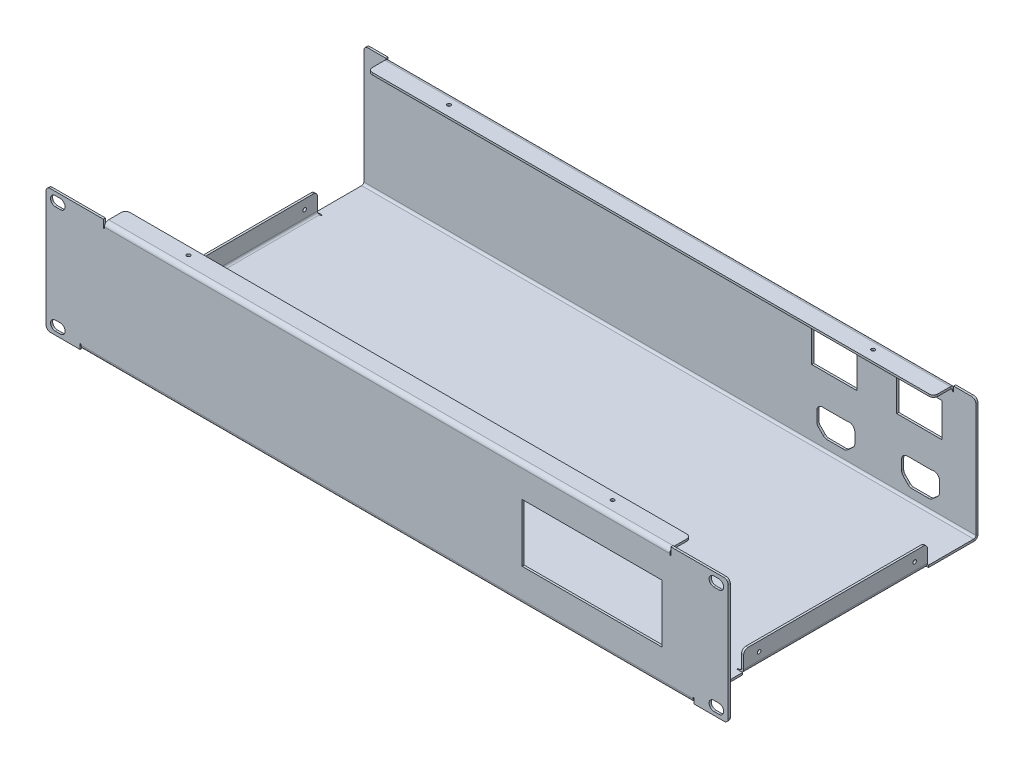
from build123d import *

# Parameters (mm, degrees)
SKETCH_1_W                        = 482.6
SKETCH_1_H                        = 88.1
SM_BASE_FLANGE_1_DEPTH            = 1.5
FILLET_1_R                        = 3
CUT_EXTRUDE_1_DEPTH               = 246.292361275
PATTERN_LINEAR_1_COUNT            = 2
PATTERN_LINEAR_1_PITCH            = 76.2
MIRROR_1_COPY_1_DEPTH             = 246.292361275
SM_START                          = -3
SM_EDGE_FLANGE_1_DEPTH            = 4
SM_START_2                        = -15
SM_EDGE_FLANGE_1_2_OUTLINE_W      = 400
SM_EDGE_FLANGE_1_2_OUTLINE_H      = 1.5
SM_EDGE_FLANGE_1_2_DEPTH          = 12
SM_START_3                        = -200
SM_EDGE_FLANGE_1_3_DEPTH          = 400
SM_EDGE_FLANGE_1_4_DEPTH          = 400
SM_EDGE_FLANGE_2_STRIP_W          = 9
SM_EDGE_FLANGE_2_STRIP_H          = 1.5
SM_EDGE_FLANGE_2_STRIP_CUT_DEPTH  = 433
SM_EDGE_FLANGE_2_RELIEF_W         = 9.75
SM_EDGE_FLANGE_2_RELIEF_H         = 0.75
SM_EDGE_FLANGE_2_RELIEF_CUT_DEPTH = 1.5
SM_EDGE_FLANGE_2_DEPTH            = 433
SM_EDGE_FLANGE_3_STRIP_W          = 10.5
SM_EDGE_FLANGE_3_STRIP_H          = 1.5
SM_EDGE_FLANGE_3_STRIP_CUT_DEPTH  = 433
SM_EDGE_FLANGE_3_DEPTH            = 433
SM_EDGE_FLANGE_4_STRIP_W          = 9
SM_EDGE_FLANGE_4_STRIP_H          = 1.5
SM_EDGE_FLANGE_4_STRIP_CUT_DEPTH  = 400
SM_EDGE_FLANGE_4_RELIEF_W         = 9.75
SM_EDGE_FLANGE_4_RELIEF_H         = 0.75
SM_EDGE_FLANGE_4_RELIEF_CUT_DEPTH = 1.5
SM_EDGE_FLANGE_4_DEPTH            = 400
SM_START_4                        = -45
SM_EDGE_FLANGE_5_DEPTH            = 1.09589
SM_START_5                        = -43.90843
SM_EDGE_FLANGE_5_2_DEPTH          = 2.85843
SM_START_6                        = -41.05
SM_EDGE_FLANGE_5_3_OUTLINE_W      = 1.5
SM_EDGE_FLANGE_5_3_OUTLINE_H      = 130
SM_EDGE_FLANGE_5_3_DEPTH          = 12
SM_START_7                        = -165.75
SM_EDGE_FLANGE_5_4_DEPTH          = 130
SM_EDGE_FLANGE_5_5_DEPTH          = 130
FILLET_2_R                        = 3
SKETCH_24_R                       = 1.25
CUT_EXTRUDE_2_DEPTH               = 503.119002329
CUT_EXTRUDE_START                 = -1.5
SKETCH_25_R                       = 1.25
CUT_EXTRUDE_3_DEPTH               = 1.5
SKETCH1_W                         = 32
SKETCH1_H                         = 24
CUT_EXTRUDE1_DEPTH                = 10
SKETCH2_W                         = 99
SKETCH2_H                         = 41
CUT_EXTRUDE2_DEPTH                = 11


with BuildPart() as part:
    # Базовая кромка1: sheet metal written as solids
    # Sketch 1 → Базовая кромка1 (new body)
    with BuildSketch(Plane.XY):
        Rectangle(SKETCH_1_W, SKETCH_1_H)
    extrude(amount=-SM_BASE_FLANGE_1_DEPTH)

    # Скругление1
    fillet_1_edges = [part.edges().sort_by_distance(p)[0] for p in [
        (-241.3, 44.05, -0.75),
        (241.3, 44.05, -0.75),
        (241.3, -44.05, -0.75),
        (-241.3, -44.05, -0.75),
    ]]
    fillet(fillet_1_edges, radius=FILLET_1_R)

    # Эскиз6 → Вырез-Вытянуть1 (cut, through all)
    with BuildSketch(Plane.XY):
        with BuildLine():
            Line((-234.7, -34.75), (-231.2, -34.75))
            ThreePointArc((-231.2, -34.75), (-227.8, -38.15), (-231.2, -41.55))
            Line((-231.2, -41.55), (-234.7, -41.55))
            ThreePointArc((-234.7, -41.55), (-238.1, -38.15), (-234.7, -34.75))
        make_face()
    cut_extrude_1 = extrude(amount=-CUT_EXTRUDE_1_DEPTH, mode=Mode.SUBTRACT)

    # Линейный массив1: Вырез-Вытянуть1 ×2
    with Locations(*[(0, i * PATTERN_LINEAR_1_PITCH, 0) for i in range(1, PATTERN_LINEAR_1_COUNT)]):
        add(cut_extrude_1, mode=Mode.SUBTRACT)

    # Зеркальное отражение1: Вырез-Вытянуть1 across plane
    add(cut_extrude_1.mirror(Plane(origin=(0, 0, 0), x_dir=(0, 0, 1), z_dir=(1, 0, 0))), mode=Mode.SUBTRACT)

    # Зеркальное отражение1 copy 1 sketch → Зеркальное отражение1 copy 1 (cut, through all)
    with BuildSketch(Plane(origin=(0, 76.2, 0), x_dir=(-1, 0, 0), z_dir=(0, 0, 1))):
        with BuildLine():
            Line((-234.7, 34.75), (-231.2, 34.75))
            ThreePointArc((-231.2, 34.75), (-227.8, 38.15), (-231.2, 41.55))
            Line((-231.2, 41.55), (-234.7, 41.55))
            ThreePointArc((-234.7, 41.55), (-238.1, 38.15), (-234.7, 34.75))
        make_face()
    extrude(amount=-MIRROR_1_COPY_1_DEPTH, mode=Mode.SUBTRACT)

    # Ребро-кромка1: read off the stored shape, not the designer's step
    # Ребро-кромка1 outline → Ребро-кромка1 (cut)
    with BuildSketch(Plane.XY.offset(SM_START)):
        with BuildLine():
            Line((200.75, 38.8), (200.75, 44.05))
            Line((200.75, 44.05), (-200.75, 44.05))
            Line((-200.75, 44.05), (-200.75, 38.8))
            ThreePointArc((-200.75, 38.8), (-200.375, 38.425), (-200, 38.8))
            Line((-200, 38.8), (-200, 42.55))
            Line((-200, 42.55), (200, 42.55))
            Line((200, 42.55), (200, 38.8))
            ThreePointArc((200, 38.8), (200.375, 38.425), (200.75, 38.8))
        make_face()
    extrude(amount=SM_EDGE_FLANGE_1_DEPTH, mode=Mode.SUBTRACT)

    # Sm Edge Flange 1 3 outline → Sm Edge Flange 1 3 (cut)
    with BuildSketch(Plane.YZ.offset(SM_START_3)):
        with BuildLine():
            ThreePointArc((39.55, 0), (41.05, -0.401923788), (42.148076212, -1.5))
            Line((42.148076212, -1.5), (42.55, -1.5))
            Line((42.55, -1.5), (42.55, 0))
            Line((42.55, 0), (39.55, 0))
        make_face()
    extrude(amount=SM_EDGE_FLANGE_1_3_DEPTH, mode=Mode.SUBTRACT)



with BuildPart() as body_2:
    # Sm Edge Flange 1 2 outline → Sm Edge Flange 1 2 (new body)
    with BuildSketch(Plane.XY.offset(SM_START_2)):
        with Locations((0, 41.8)):
            Rectangle(SM_EDGE_FLANGE_1_2_OUTLINE_W, SM_EDGE_FLANGE_1_2_OUTLINE_H)
    extrude(amount=SM_EDGE_FLANGE_1_2_DEPTH)


with BuildPart() as part_1:
    add(part.part)

    add(body_2.part)  # Sm Edge Flange 1 4 merges body 2
    # Sm Edge Flange 1 4 outline → Sm Edge Flange 1 4 (add)
    with BuildSketch(Plane.YZ.offset(SM_START_3)):
        with BuildLine():
            Line((41.05, -3), (42.55, -3))
            ThreePointArc((42.55, -3), (42.447777479, -2.223542865), (42.148076212, -1.5))
            Line((42.148076212, -1.5), (39.55, -1.5))
            ThreePointArc((39.55, -1.5), (40.610660172, -1.939339828), (41.05, -3))
        make_face()
    extrude(amount=SM_EDGE_FLANGE_1_4_DEPTH)

    # Ребро-кромка2: sheet metal written as solids
    # Ребро-кромка2 strip (on a plane across the edge) → Ребро-кромка2 strip cut (cut)
    with BuildSketch(Plane(origin=(216.5, -44.05, -1.5), x_dir=(0, 1, 0), z_dir=(-1, 0, 0))):
        with Locations((-1.5, -0.75)):
            Rectangle(SM_EDGE_FLANGE_2_STRIP_W, SM_EDGE_FLANGE_2_STRIP_H)
    extrude(amount=SM_EDGE_FLANGE_2_STRIP_CUT_DEPTH, mode=Mode.SUBTRACT)

    # Ребро-кромка2 relief (on the sheet) → Ребро-кромка2 relief cut (cut)
    with BuildSketch(Plane(origin=(216.5, -41.05, -1.5), x_dir=(0, 1, 0), z_dir=(0, 0, -1))):
        with Locations((-4.125, 0.375)):
            Rectangle(SM_EDGE_FLANGE_2_RELIEF_W, SM_EDGE_FLANGE_2_RELIEF_H)
        with Locations((-4.125, -433.375)):
            Rectangle(SM_EDGE_FLANGE_2_RELIEF_W, SM_EDGE_FLANGE_2_RELIEF_H)
    extrude(amount=-SM_EDGE_FLANGE_2_RELIEF_CUT_DEPTH, mode=Mode.SUBTRACT)

    # Ребро-кромка2 section (on a plane across the edge) → Ребро-кромка2 (add)
    with BuildSketch(Plane(origin=(216.5, -44.05, -1.5), x_dir=(0, 1, 0), z_dir=(-1, 0, 0))):
        with BuildLine():
            Line((0, 1.5), (0, 198.5))
            Line((0, 198.5), (1.5, 198.5))
            Line((1.5, 198.5), (1.5, 1.5))
            ThreePointArc((1.5, 1.5), (1.939339828, 0.439339828), (3, 0))
            Line((3, 0), (3, -1.5))
            ThreePointArc((3, -1.5), (0.878679656, -0.621320344), (0, 1.5))
        make_face()
    extrude(amount=SM_EDGE_FLANGE_2_DEPTH)

    # Ребро-кромка3: sheet metal written as solids
    # Ребро-кромка3 strip (on a plane across the edge) → Ребро-кромка3 strip cut (cut)
    with BuildSketch(Plane(origin=(216.5, -42.55, -201.5), x_dir=(0, 0, 1), z_dir=(-1, 0, 0))):
        with Locations((-2.25, -0.75)):
            Rectangle(SM_EDGE_FLANGE_3_STRIP_W, SM_EDGE_FLANGE_3_STRIP_H)
    extrude(amount=SM_EDGE_FLANGE_3_STRIP_CUT_DEPTH, mode=Mode.SUBTRACT)

    # Ребро-кромка3 section (on a plane across the edge) → Ребро-кромка3 (add)
    with BuildSketch(Plane(origin=(216.5, -42.55, -201.5), x_dir=(0, 0, 1), z_dir=(-1, 0, 0))):
        with BuildLine():
            Line((0, 1.5), (0, 85.1))
            Line((0, 85.1), (1.5, 85.1))
            Line((1.5, 85.1), (1.5, 1.5))
            ThreePointArc((1.5, 1.5), (1.939339828, 0.439339828), (3, 0))
            Line((3, 0), (3, -1.5))
            ThreePointArc((3, -1.5), (0.878679656, -0.621320344), (0, 1.5))
        make_face()
    extrude(amount=SM_EDGE_FLANGE_3_DEPTH)

    # Ребро-кромка4: sheet metal written as solids
    # Ребро-кромка4 strip (on a plane across the edge) → Ребро-кромка4 strip cut (cut)
    with BuildSketch(Plane(origin=(200, 42.55, -200), x_dir=(0, -1, 0), z_dir=(-1, 0, 0))):
        with Locations((-1.5, -0.75)):
            Rectangle(SM_EDGE_FLANGE_4_STRIP_W, SM_EDGE_FLANGE_4_STRIP_H)
    extrude(amount=SM_EDGE_FLANGE_4_STRIP_CUT_DEPTH, mode=Mode.SUBTRACT)

    # Ребро-кромка4 relief (on the sheet) → Ребро-кромка4 relief cut (cut)
    with BuildSketch(Plane(origin=(200, 39.55, -200), x_dir=(0, -1, 0), z_dir=(0, 0, 1))):
        with Locations((-4.125, 0.375)):
            Rectangle(SM_EDGE_FLANGE_4_RELIEF_W, SM_EDGE_FLANGE_4_RELIEF_H)
        with Locations((-4.125, -400.375)):
            Rectangle(SM_EDGE_FLANGE_4_RELIEF_W, SM_EDGE_FLANGE_4_RELIEF_H)
    extrude(amount=-SM_EDGE_FLANGE_4_RELIEF_CUT_DEPTH, mode=Mode.SUBTRACT)

    # Ребро-кромка4 section (on a plane across the edge) → Ребро-кромка4 (add)
    with BuildSketch(Plane(origin=(200, 42.55, -200), x_dir=(0, -1, 0), z_dir=(-1, 0, 0))):
        with BuildLine():
            Line((0, 1.5), (0, 13.5))
            Line((0, 13.5), (1.5, 13.5))
            Line((1.5, 13.5), (1.5, 1.5))
            ThreePointArc((1.5, 1.5), (1.939339828, 0.439339828), (3, 0))
            Line((3, 0), (3, -1.5))
            ThreePointArc((3, -1.5), (0.878679656, -0.621320344), (0, 1.5))
        make_face()
    extrude(amount=SM_EDGE_FLANGE_4_DEPTH)

    # Ребро-кромка5: read off the stored shape, not the designer's step
    # Ребро-кромка5 outline → Ребро-кромка5 (cut)
    with BuildSketch(Plane(origin=(0, 0, 0), x_dir=(1, 0, 0), z_dir=(0, 1, 0)).offset(SM_START_4)):
        with BuildLine():
            Line((-216.5, 35), (-212.75, 35))
            ThreePointArc((-212.75, 35), (-212.375, 35.375), (-212.75, 35.75))
            Line((-212.75, 35.75), (-215, 35.75))
            Line((-215, 35.75), (-215, 165.75))
            Line((-215, 165.75), (-212.75, 165.75))
            ThreePointArc((-212.75, 165.75), (-212.375, 166.125), (-212.75, 166.5))
            Line((-212.75, 166.5), (-216.5, 166.5))
            Line((-216.5, 166.5), (-216.5, 35))
        make_face()
        with BuildLine():
            Line((216.5, 166.5), (212.75, 166.5))
            ThreePointArc((212.75, 166.5), (212.375, 166.125), (212.75, 165.75))
            Line((212.75, 165.75), (215, 165.75))
            Line((215, 165.75), (215, 35.75))
            Line((215, 35.75), (212.75, 35.75))
            ThreePointArc((212.75, 35.75), (212.375, 35.375), (212.75, 35))
            Line((212.75, 35), (216.5, 35))
            Line((216.5, 35), (216.5, 166.5))
        make_face()
    extrude(amount=SM_EDGE_FLANGE_5_DEPTH, mode=Mode.SUBTRACT)

    # Sm Edge Flange 5 2 outline → Sm Edge Flange 5 2 (cut)
    with BuildSketch(Plane(origin=(0, 0, 0), x_dir=(1, 0, 0), z_dir=(0, 1, 0)).offset(SM_START_5)):
        with BuildLine():
            Line((-212.75, 35.75), (-216.5, 35.75))
            Line((-216.5, 35.75), (-216.5, 35))
            Line((-216.5, 35), (-212.75, 35))
            ThreePointArc((-212.75, 35), (-212.375, 35.375), (-212.75, 35.75))
        make_face()
        with BuildLine():
            Line((-216.5, 166.5), (-216.5, 165.75))
            Line((-216.5, 165.75), (-212.75, 165.75))
            ThreePointArc((-212.75, 165.75), (-212.375, 166.125), (-212.75, 166.5))
            Line((-212.75, 166.5), (-216.5, 166.5))
        make_face()
        with BuildLine():
            Line((212.75, 165.75), (216.5, 165.75))
            Line((216.5, 165.75), (216.5, 166.5))
            Line((216.5, 166.5), (212.75, 166.5))
            ThreePointArc((212.75, 166.5), (212.375, 166.125), (212.75, 165.75))
        make_face()
        with BuildLine():
            Line((216.5, 35), (216.5, 35.75))
            Line((216.5, 35.75), (212.75, 35.75))
            ThreePointArc((212.75, 35.75), (212.375, 35.375), (212.75, 35))
            Line((212.75, 35), (216.5, 35))
        make_face()
    extrude(amount=SM_EDGE_FLANGE_5_2_DEPTH, mode=Mode.SUBTRACT)

    # Sm Edge Flange 5 4 outline → Sm Edge Flange 5 4 (cut)
    with BuildSketch(Plane.XY.offset(SM_START_7)):
        with BuildLine():
            Line((216.5, -42.55), (216.098076212, -42.55))
            ThreePointArc((216.098076212, -42.55), (215, -43.648076212), (213.5, -44.05))
            Line((213.5, -44.05), (215, -44.05))
            Line((215, -44.05), (215, -43.90411))
            Line((215, -43.90411), (216.5, -43.90411))
            Line((216.5, -43.90411), (216.5, -42.55))
        make_face()
        with BuildLine():
            Line((-215, -44.05), (-213.5, -44.05))
            ThreePointArc((-213.5, -44.05), (-215, -43.648076212), (-216.098076212, -42.55))
            Line((-216.098076212, -42.55), (-216.5, -42.55))
            Line((-216.5, -42.55), (-216.5, -43.90411))
            Line((-216.5, -43.90411), (-215, -43.90411))
            Line((-215, -43.90411), (-215, -44.05))
        make_face()
    extrude(amount=SM_EDGE_FLANGE_5_4_DEPTH, mode=Mode.SUBTRACT)



with BuildPart() as body_2_2:
    # Sm Edge Flange 5 3 outline → Sm Edge Flange 5 3 (new body)
    with BuildSketch(Plane(origin=(0, 0, 0), x_dir=(1, 0, 0), z_dir=(0, 1, 0)).offset(SM_START_6)):
        with Locations((-215.75, 100.75)):
            Rectangle(SM_EDGE_FLANGE_5_3_OUTLINE_W, SM_EDGE_FLANGE_5_3_OUTLINE_H)
        with Locations((215.75, 100.75)):
            Rectangle(SM_EDGE_FLANGE_5_3_OUTLINE_W, SM_EDGE_FLANGE_5_3_OUTLINE_H)
    extrude(amount=SM_EDGE_FLANGE_5_3_DEPTH)


with BuildPart() as part_2:
    add(part_1.part)

    add(body_2_2.part)  # Sm Edge Flange 5 5 merges body 2 2
    # Sm Edge Flange 5 5 outline → Sm Edge Flange 5 5 (add)
    with BuildSketch(Plane.XY.offset(SM_START_7)):
        with BuildLine():
            ThreePointArc((216.098076212, -42.55), (216.397777479, -41.826457135), (216.5, -41.05))
            Line((216.5, -41.05), (215, -41.05))
            ThreePointArc((215, -41.05), (214.560660172, -42.110660172), (213.5, -42.55))
            Line((213.5, -42.55), (216.098076212, -42.55))
        make_face()
        with BuildLine():
            Line((-216.098076212, -42.55), (-213.5, -42.55))
            ThreePointArc((-213.5, -42.55), (-214.560660172, -42.110660172), (-215, -41.05))
            Line((-215, -41.05), (-216.5, -41.05))
            ThreePointArc((-216.5, -41.05), (-216.397777479, -41.826457135), (-216.098076212, -42.55))
        make_face()
    extrude(amount=SM_EDGE_FLANGE_5_5_DEPTH)

    # Скругление2
    fillet_2_edges = [part_2.edges().sort_by_distance(p)[0] for p in [
        (-200, 41.8, -15),
        (200, 41.8, -15),
        (216.5, 42.55, -200.75),
        (-216.5, 42.55, -200.75),
        (200, 41.8, -186.5),
        (-200, 41.8, -186.5),
        (215.75, -29.05, -35.75),
        (215.75, -29.05, -165.75),
        (-215.75, -29.05, -165.75),
        (-215.75, -29.05, -35.75),
    ]]
    fillet(fillet_2_edges, radius=FILLET_2_R)

    # Эскиз24 → Вырез-Вытянуть2 (cut, through all)
    with BuildSketch(Plane(origin=(216.5, 0, 0), x_dir=(0, 0, -1), z_dir=(1, 0, 0))):
        with Locations(Location((46.65, -35.65, 0), (0, 0, 90))):
            Circle(SKETCH_24_R)
        with Locations(Location((156.65, -35.65, 0), (0, 0, 90))):
            Circle(SKETCH_24_R)
    extrude(amount=-CUT_EXTRUDE_2_DEPTH, mode=Mode.SUBTRACT)

    # Эскиз25 → Вырез-Вытянуть3 (cut)
    with BuildSketch(Plane(origin=(0, 42.55, 0), x_dir=(1, 0, 0), z_dir=(0, 1, 0)).offset(CUT_EXTRUDE_START)):
        with Locations(Location((-150, 9.5, 0), (0, 0, 270))):
            Circle(SKETCH_25_R)
        with Locations(Location((150, 9.5, 0), (0, 0, 270))):
            Circle(SKETCH_25_R)
        with Locations(Location((150, 193.8, 0), (0, 0, 270))):
            Circle(SKETCH_25_R)
        with Locations(Location((-150, 193.8, 0), (0, 0, 270))):
            Circle(SKETCH_25_R)
    extrude(amount=CUT_EXTRUDE_3_DEPTH, mode=Mode.SUBTRACT)

    # Sketch1 → Cut-Extrude1 (cut)
    with BuildSketch(Plane.XY.offset(-200)):
        with BuildLine():
            Line((185.204387844, -16.718695122), (167.775585228, -16.718695122))
            ThreePointArc((167.775585228, -16.718695122), (165.093784807, -17.960084717), (163.943244567, -20.682098453))
            Line((163.943244567, -20.682098453), (163.943244567, -27.646929638))
            ThreePointArc((163.943244567, -27.646929638), (164.260774713, -29.200416295), (165.144005486, -30.517249461))
            Line((165.144005486, -30.517249461), (168.536646173, -33.909890149))
            ThreePointArc((168.536646173, -33.909890149), (169.546562747, -34.649549283), (170.732592404, -35.05))
            Line((170.732592404, -35.05), (182.247380668, -35.05))
            ThreePointArc((182.247380668, -35.05), (184.187709088, -34.919651477), (185.849710043, -33.909890149))
            Line((185.849710043, -33.909890149), (189.444747012, -30.732512165))
            ThreePointArc((189.444747012, -30.732512165), (190.478488056, -29.341128896), (190.844898781, -27.646929638))
            Line((190.844898781, -27.646929638), (190.844898781, -20.682098453))
            ThreePointArc((190.844898781, -20.682098453), (189.105424594, -17.162284683), (185.204387844, -16.718695122))
        make_face()
        with BuildLine():
            Line((125.204387844, -16.718695122), (107.775585228, -16.718695122))
            ThreePointArc((107.775585228, -16.718695122), (105.093784807, -17.960084717), (103.943244567, -20.682098453))
            Line((103.943244567, -20.682098453), (103.943244567, -27.646929638))
            ThreePointArc((103.943244567, -27.646929638), (104.260774713, -29.200416295), (105.144005486, -30.517249461))
            Line((105.144005486, -30.517249461), (108.536646173, -33.909890149))
            ThreePointArc((108.536646173, -33.909890149), (109.546562747, -34.649549283), (110.732592404, -35.05))
            Line((110.732592404, -35.05), (122.247380668, -35.05))
            ThreePointArc((122.247380668, -35.05), (124.187709088, -34.919651477), (125.849710043, -33.909890149))
            Line((125.849710043, -33.909890149), (129.444747012, -30.732512165))
            ThreePointArc((129.444747012, -30.732512165), (130.478488056, -29.341128896), (130.844898781, -27.646929638))
            Line((130.844898781, -27.646929638), (130.844898781, -20.682098453))
            ThreePointArc((130.844898781, -20.682098453), (129.105424594, -17.162284683), (125.204387844, -16.718695122))
        make_face()
        with Locations((116.315093882, 17.55)):
            Rectangle(SKETCH1_W, SKETCH1_H)
        with Locations((176.489986536, 17.55)):
            Rectangle(SKETCH1_W, SKETCH1_H)
    extrude(amount=-CUT_EXTRUDE1_DEPTH, mode=Mode.SUBTRACT)

    # Sketch2 → Cut-Extrude2 (cut)
    with BuildSketch(Plane.XY):
        with Locations((145, 0)):
            Rectangle(SKETCH2_W, SKETCH2_H)
    extrude(amount=-CUT_EXTRUDE2_DEPTH, mode=Mode.SUBTRACT)


solid = part_2.part
